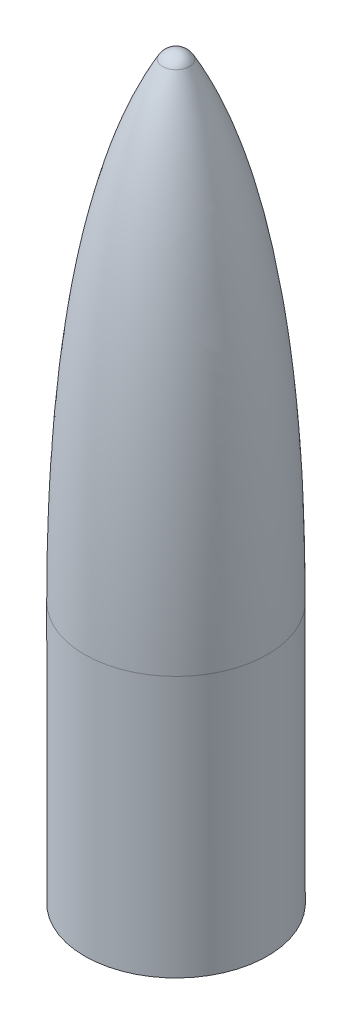
from build123d import *

# Parameters (mm, degrees)
SCHIZZO1_R                   = 17.5
ESTRUSIONE_ESTRUSIONE1_DEPTH = 50
TAGLIO_ESTRUSIONE1_REACH     = 145.634
SCHIZZO10_R                  = 16.3
SKETCH1_R                    = 16.3
SKETCH1_R_2                  = 14.8
BOSS_EXTRUDE3_DEPTH          = 15
SKETCH2_R                    = 2.2
BOSS_EXTRUDE4_DEPTH          = 5


# Read off the part's stored shape, not the designer's step: Rivoluzione1
with BuildPart() as part:
    # Schizzo1 → Estrusione-Estrusione1 (new body)
    with BuildSketch(Plane(origin=(0, 0, 0), x_dir=(1, 0, 0), z_dir=(0, 1, 0))):
        with Locations(Location((0, 0, 0), (0, 0, 270))):
            Circle(SCHIZZO1_R)
    extrude(amount=ESTRUSIONE_ESTRUSIONE1_DEPTH)

    # Rivoluzione1 outline → Rivoluzione1 (revolve)
    with BuildSketch(Plane.XY):
        with BuildLine():
            ThreePointArc((2.55, 139.999999998), (1.475612648, 141.087167398), (0, 141.485675179))
            Line((0, 141.485675179), (0, 138.8))
            Line((0, 138.8), (2, 138.8))
            add(Edge.make_bspline(
                [(2, 138.8), (16.3, 113.62789219), (16.3, 50)],
                knots=[0, 0, 0, 1, 1, 1], degree=2))
            Line((16.3, 50), (17.5, 50))
            add(Edge.make_bspline(
                [(17.5, 50), (17.5, 113.62789219), (2.55, 139.999999998)],
                knots=[0.022396988, 0.022396988, 0.022396988, 1.022396988, 1.022396988, 1.022396988], degree=2))
        make_face()
    revolve(axis=Axis((0, 0, 0), (0, 1, 0)))

    # Schizzo10 → Taglio-Estrusione1 (cut, up to next)
    with BuildSketch(Plane(origin=(0, 0, 0), x_dir=(1, 0, 0), z_dir=(0, 1, 0)), mode=Mode.PRIVATE) as taglio_estrusione1_sk1:
        with Locations(Location((0, 0, 0), (0, 0, 270))):
            Circle(SCHIZZO10_R)
    taglio_estrusione1_tool1 = extrude(taglio_estrusione1_sk1.sketch, amount=TAGLIO_ESTRUSIONE1_REACH, mode=Mode.PRIVATE) & part.part
    add(taglio_estrusione1_tool1.solids().sort_by_distance((0, 0, 0))[0], mode=Mode.SUBTRACT)

    # Sketch1 → Boss-Extrude3 (add)
    with BuildSketch(Plane.XZ):
        with Locations(Location((0, 0, 0), (0, 0, 270))):
            Circle(SKETCH1_R)
        with Locations(Location((0, 0, 0), (0, 0, 270))):
            Circle(SKETCH1_R_2, mode=Mode.SUBTRACT)
    extrude(amount=-BOSS_EXTRUDE3_DEPTH)

    # Sketch2 → Boss-Extrude4 (add)
    # profile 1 of 2: a face of its own
    with BuildSketch(Plane.XZ):
        with BuildLine():
            ThreePointArc((8.3, 4.3829214), (3.9170786, 0), (8.3, -4.3829214))
            Line((8.3, -4.3829214), (14.136123938, -4.3829214))
            ThreePointArc((14.136123938, -4.3829214), (14.8, 0), (14.136123938, 4.3829214))
            Line((14.136123938, 4.3829214), (8.3, 4.3829214))
        make_face()
        with Locations(Location((8.3, 0, 0), (0, 0, 270))):
            Circle(SKETCH2_R, mode=Mode.SUBTRACT)
    # profile 2 of 2: a face of its own
    with BuildSketch(Plane.XZ):
        with BuildLine():
            Line((-8.3, 4.3829214), (-14.136123938, 4.3829214))
            ThreePointArc((-14.136123938, 4.3829214), (-14.8, 0), (-14.136123938, -4.3829214))
            Line((-14.136123938, -4.3829214), (-8.3, -4.3829214))
            ThreePointArc((-8.3, -4.3829214), (-3.9170786, 0), (-8.3, 4.3829214))
        make_face()
        with Locations(Location((-8.3, 0, 0), (0, 0, 270))):
            Circle(SKETCH2_R, mode=Mode.SUBTRACT)
    extrude(amount=-BOSS_EXTRUDE4_DEPTH)


solid = part.part
